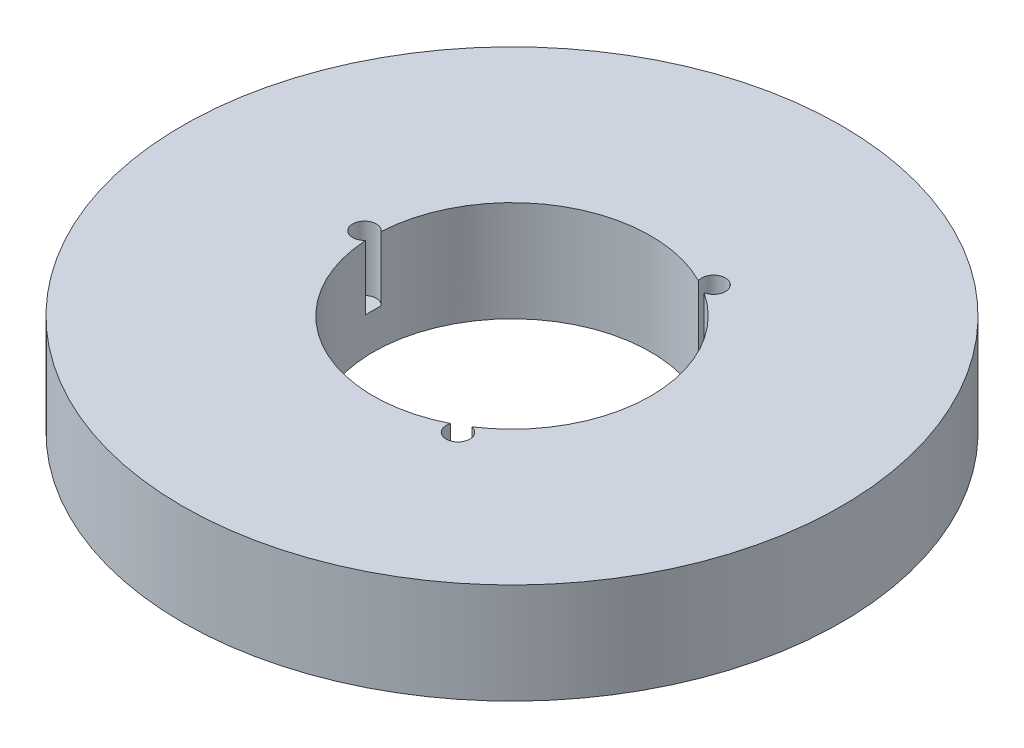
from build123d import *

# Parameters (mm, degrees)
SKETCH1_R           = 95
BOSS_EXTRUDE1_DEPTH = 29
SKETCH2_R           = 40
CUT_EXTRUDE1_DEPTH  = 138.444534267
SKETCH3_R           = 3.416653433
CUT_EXTRUDE2_DEPTH  = 18.580646215
CIRPATTERN1_COUNT   = 3


with BuildPart() as part:
    # Sketch1 → Boss-Extrude1 (new body)
    with BuildSketch(Plane(origin=(0, 0, 0), x_dir=(1, 0, 0), z_dir=(0, 1, 0))):
        Circle(SKETCH1_R)
    extrude(amount=BOSS_EXTRUDE1_DEPTH)

    # Sketch2 → Cut-Extrude1 (cut, through all)
    with BuildSketch(Plane(origin=(0, 0, 0), x_dir=(1, 0, 0), z_dir=(0, 1, 0))):
        Circle(SKETCH2_R)
    extrude(amount=CUT_EXTRUDE1_DEPTH, mode=Mode.SUBTRACT)

    # Sketch3 → Cut-Extrude2 (cut)
    with BuildSketch(Plane(origin=(0, 29, 0), x_dir=(1, 0, 0), z_dir=(0, 1, 0))):
        with Locations((-42.527878276, 0)):
            Circle(SKETCH3_R)
    cut_extrude2 = extrude(amount=-CUT_EXTRUDE2_DEPTH, mode=Mode.SUBTRACT)

    # CirPattern1: Cut-Extrude2 ×3 about axis
    cirpattern1_axis = Axis((0, 0, 0), (0, 1, 0))
    for i in range(1, CIRPATTERN1_COUNT):
        add(cut_extrude2.rotate(cirpattern1_axis, i * 360 / CIRPATTERN1_COUNT), mode=Mode.SUBTRACT)


solid = part.part
